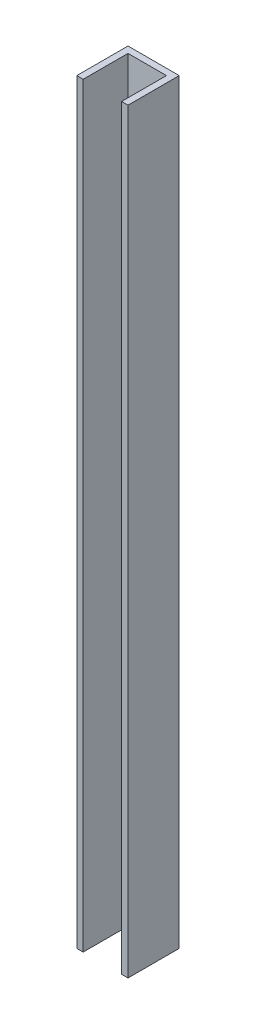
from build123d import *

# Parameters (mm, degrees)
BOSS_EXTRUDE1_DEPTH = 374.65


with BuildPart() as part:
    # Sketch1 → Boss-Extrude1 (new body)
    with BuildSketch(Plane(origin=(0, 0, 0), x_dir=(1, 0, 0), z_dir=(0, 1, 0))):
        Polygon((0, 0), (3.175, 0), (3.175, 22.225), (22.225, 22.225), (22.225, 0), (25.4, 0), (25.4, 25.4), (0, 25.4), align=None)
    extrude(amount=BOSS_EXTRUDE1_DEPTH)


solid = part.part
